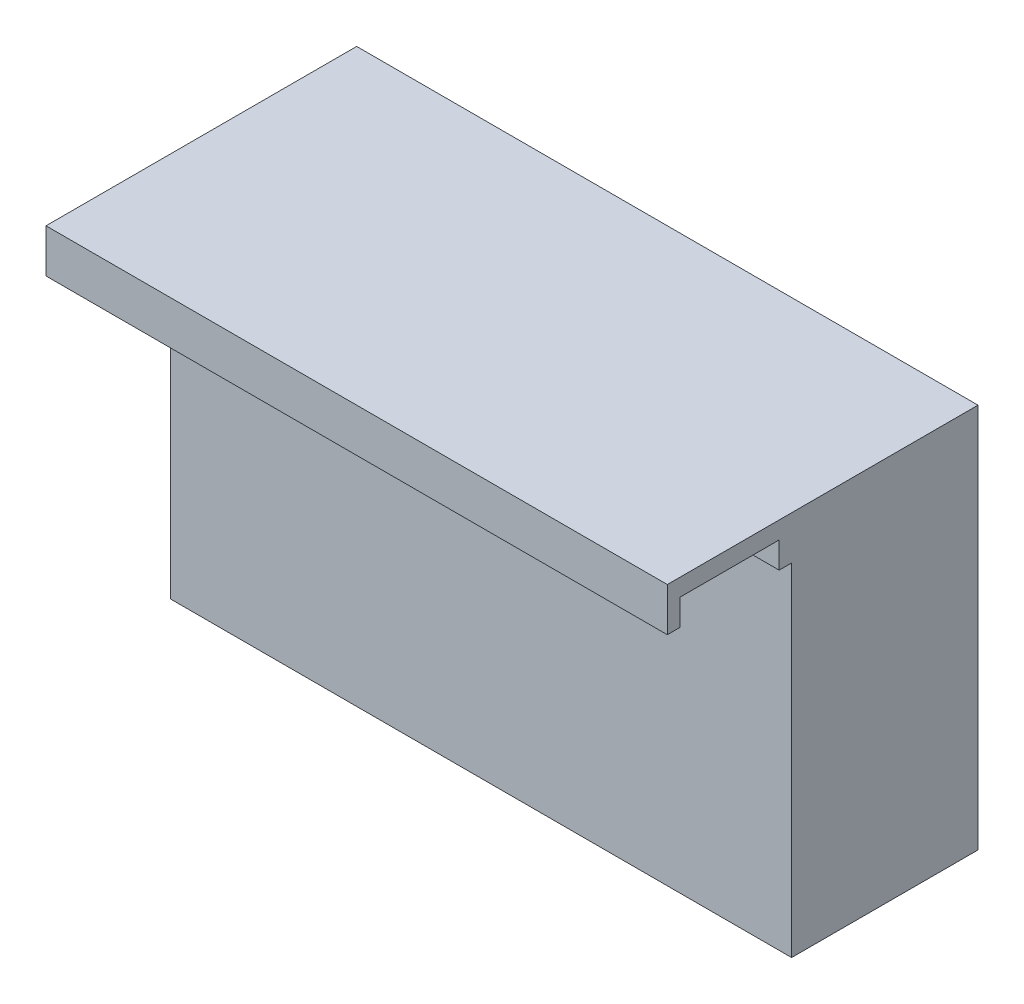
from build123d import *

# Parameters (mm, degrees)
SKETCH1_W           = 100
SKETCH1_H           = 20
BOSS_EXTRUDE1_DEPTH = 7
SKETCH2_W           = 16
SKETCH2_H           = 8.428142516
CUT_EXTRUDE1_DEPTH  = 103.220350224
SKETCH3_W           = 100
SKETCH3_H           = 62
BOSS_EXTRUDE2_DEPTH = 30
SKETCH4_W           = 88
SKETCH4_H           = 56.5
CUT_EXTRUDE2_DEPTH  = 27.5
SKETCH5_W           = 7.686328358
SKETCH5_H           = 52.5
CUT_EXTRUDE3_DEPTH  = 120.837389825
SKETCH6_W           = 27.5
SKETCH6_H           = 13
CUT_EXTRUDE4_DEPTH  = 3
SKETCH7_W           = 58
SKETCH7_H           = 2.3
CUT_EXTRUDE5_DEPTH  = 23
CUT_EXTRUDE6_DEPTH  = 23


with BuildPart() as part:
    # Sketch1 → Boss-Extrude1 (new body)
    with BuildSketch(Plane(origin=(0, 0, 0), x_dir=(1, 0, 0), z_dir=(0, 1, 0))):
        with Locations((-50, 10)):
            Rectangle(SKETCH1_W, SKETCH1_H)
    extrude(amount=BOSS_EXTRUDE1_DEPTH)

    # Sketch2 → Cut-Extrude1 (cut, through all)
    with BuildSketch(Plane.ZY.offset(100)):
        with Locations((-10, 0)):
            Rectangle(SKETCH2_W, SKETCH2_H)
    extrude(amount=-CUT_EXTRUDE1_DEPTH, mode=Mode.SUBTRACT)

    # Sketch3 → Boss-Extrude2 (add)
    with BuildSketch(Plane(origin=(0, 0, -20), x_dir=(-1, 0, 0), z_dir=(0, 0, -1))):
        with Locations((50, -24)):
            Rectangle(SKETCH3_W, SKETCH3_H)
    extrude(amount=BOSS_EXTRUDE2_DEPTH)

    # Sketch4 → Cut-Extrude2 (cut)
    with BuildSketch(Plane(origin=(0, 0, -50), x_dir=(-1, 0, 0), z_dir=(0, 0, -1))):
        with Locations((50, -24)):
            Rectangle(SKETCH4_W, SKETCH4_H)
    extrude(amount=-CUT_EXTRUDE2_DEPTH, mode=Mode.SUBTRACT)

    # Sketch5 → Cut-Extrude3 (cut, through all)
    with BuildSketch(Plane(origin=(-94, 0, 0), x_dir=(0, 0, -1), z_dir=(1, 0, 0))):
        with Locations((35.043164179, -24)):
            Rectangle(SKETCH5_W, SKETCH5_H)
    extrude(amount=-CUT_EXTRUDE3_DEPTH, mode=Mode.SUBTRACT)

    # Sketch6 → Cut-Extrude4 (cut)
    with BuildSketch(Plane.ZY.offset(6)):
        with Locations((-36.25, -24)):
            Rectangle(SKETCH6_W, SKETCH6_H)
    extrude(amount=-CUT_EXTRUDE4_DEPTH, mode=Mode.SUBTRACT)

    # Sketch7 → Cut-Extrude5 (cut)
    with BuildSketch(Plane(origin=(0, 0, -50), x_dir=(-1, 0, 0), z_dir=(0, 0, -1))):
        with Locations((35, -53.4)):
            Rectangle(SKETCH7_W, SKETCH7_H)
    extrude(amount=-CUT_EXTRUDE5_DEPTH, mode=Mode.SUBTRACT)

    # Sketch9 → Cut-Extrude6 (cut)
    with BuildSketch(Plane(origin=(0, -52.25, 0), x_dir=(1, 0, 0), z_dir=(0, 1, 0))):
        Polygon((-37.960647242, 38.5), (-64, 38.5), (-64, 33.5), (-37.960647242, 33.5), (-6.413001969, 33.5), (-6.413001969, 38.5), align=None)
    extrude(amount=-CUT_EXTRUDE6_DEPTH, mode=Mode.SUBTRACT)


solid = part.part
